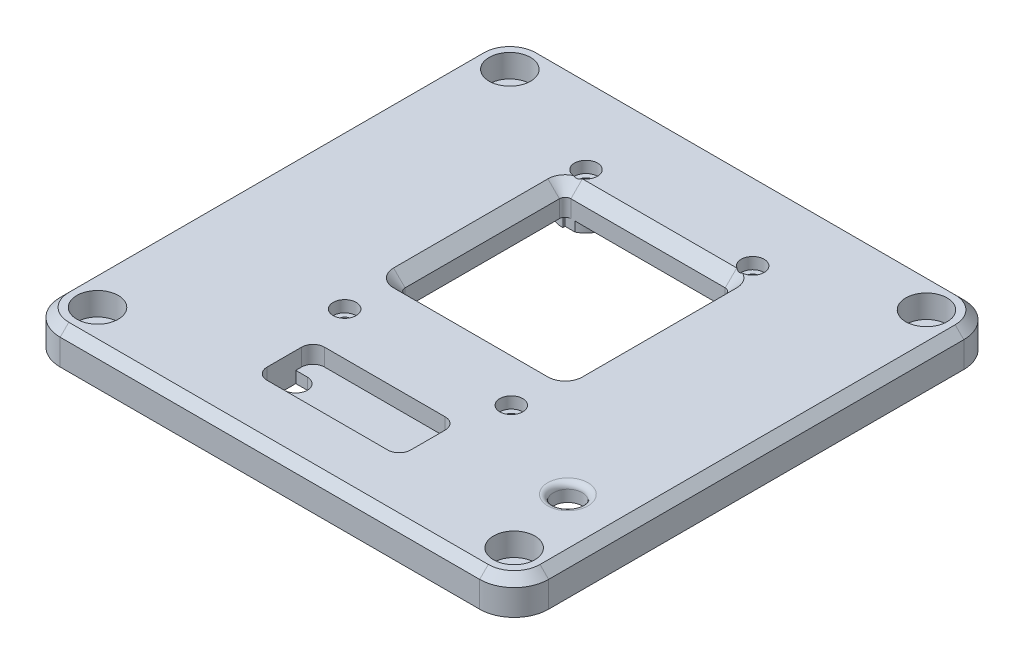
from build123d import *
from build123d.topology import SkipClean

# Parameters (mm, degrees)
SKETCH1_W                 = 85
SKETCH1_H                 = 84.25
SKETCH1_W_2               = 79
SKETCH1_H_2               = 78.25
BOSS_EXTRUDE1_DEPTH       = 3
BOSS_EXTRUDE2_START       = 3
SKETCH1_2_W               = 85
SKETCH1_2_H               = 84.25
SKETCH1_2_W_2             = 79
SKETCH1_2_H_2             = 78.25
BOSS_EXTRUDE2_DEPTH       = 3
FILLET1_R                 = 3
FILLET2_R                 = 6
CHAMFER1_SIZE             = 1.5
SKETCH3_W                 = 28.86
SKETCH3_H                 = 28.86
CUT_EXTRUDE1_DEPTH        = 61.139551254
FILLET3_R                 = 1
BOSS_EXTRUDE3_START       = 2
BOSS_EXTRUDE3_DEPTH       = 2
CHAMFER2_SIZE             = 2
SKETCH5_R                 = 1.1
CUT_EXTRUDE2_DEPTH        = 61.139551254
BOSS_EXTRUDE4_OUTLINE_R   = 1.1
BOSS_EXTRUDE4_OUTLINE_R_2 = 4.1
BOSS_EXTRUDE4_DEPTH       = 3.67
SKETCH7_R                 = 2.5
CUT_EXTRUDE3_DEPTH        = 61.210086572
SKETCH8_R                 = 2
CUT_EXTRUDE4_DEPTH        = 2
FILLET4_R                 = 1
SKETCH9_R                 = 2.05
CUT_EXTRUDE5_DEPTH        = 61.210086572
SKETCH9_3_R               = 3.6
SKETCH9_3_R_2             = 2.05
CUT_EXTRUDE6_DEPTH        = 4
BOSS_EXTRUDE7_START       = -3
SKETCH10_R                = 3.6
BOSS_EXTRUDE7_DEPTH       = 1
BOSS_EXTRUDE8_START       = -4
SKETCH10_4_R              = 3.6
SKETCH10_4_R_2            = 2.05
BOSS_EXTRUDE8_DEPTH       = 2
SKETCH11_W                = 25
SKETCH11_H                = 10
CUT_EXTRUDE7_DEPTH        = 3
SKETCH12_W                = 31
SKETCH12_H                = 16
BOSS_EXTRUDE9_DEPTH       = 2
FILLET5_R                 = 2


# Read off the part's stored shape, not the designer's step: Boss-Extrude4
with BuildPart() as part:
    # Sketch1 → Boss-Extrude1 (new body)
    with BuildSketch(Plane(origin=(0, 0, 0), x_dir=(1, 0, 0), z_dir=(0, 1, 0))):
        Rectangle(SKETCH1_W, SKETCH1_H)
        Rectangle(SKETCH1_W_2, SKETCH1_H_2, mode=Mode.SUBTRACT)
    extrude(amount=BOSS_EXTRUDE1_DEPTH)

    # Sketch1<2> → Boss-Extrude2 (add)
    # profile 1 of 2: a face of its own
    with BuildSketch(Plane(origin=(0, 0, 0), x_dir=(1, 0, 0), z_dir=(0, 1, 0)).offset(BOSS_EXTRUDE2_START)):
        Rectangle(SKETCH1_2_W, SKETCH1_2_H)
        Rectangle(SKETCH1_2_W_2, SKETCH1_2_H_2, mode=Mode.SUBTRACT)
    # profile 2 of 2: a face of its own
    with BuildSketch(Plane(origin=(0, 0, 0), x_dir=(1, 0, 0), z_dir=(0, 1, 0)).offset(BOSS_EXTRUDE2_START)):
        Rectangle(SKETCH1_2_W_2, SKETCH1_2_H_2)
    extrude(amount=BOSS_EXTRUDE2_DEPTH)

    # Fillet1
    fillet1_edges = [part.edges().sort_by_distance(p)[0] for p in [
        (-39.5, 1.5, -39.125),
        (-39.5, 1.5, 39.125),
        (39.5, 1.5, 39.125),
        (39.5, 1.5, -39.125),
    ]]
    fillet(fillet1_edges, radius=FILLET1_R)

    # Fillet2
    fillet2_edges = [part.edges().sort_by_distance(p)[0] for p in [
        (-42.5, 3, 42.125),
        (-42.5, 3, -42.125),
        (42.5, 3, -42.125),
        (42.5, 3, 42.125),
    ]]
    fillet(fillet2_edges, radius=FILLET2_R)

    # Chamfer1
    chamfer1_edges = [part.edges().sort_by_distance(p)[0] for p in [
        (42.5, 6, 0),
        (0, 6, 42.125),
        (0, 6, -42.125),
        (-42.5, 6, 0),
        (-40.742640687, 6, 40.367640687),
        (-40.742640687, 6, -40.367640687),
        (40.742640687, 6, -40.367640687),
        (40.742640687, 6, 40.367640687),
    ]]
    chamfer(chamfer1_edges, length=CHAMFER1_SIZE)

    # Sketch3 → Cut-Extrude1 (cut, through all)
    with BuildSketch(Plane(origin=(0, 6, 0), x_dir=(1, 0, 0), z_dir=(0, 1, 0))):
        with Locations((0, 9.25)):
            Rectangle(SKETCH3_W, SKETCH3_H)
    extrude(amount=-CUT_EXTRUDE1_DEPTH, mode=Mode.SUBTRACT)

    # Fillet3
    fillet3_edges = [part.edges().sort_by_distance(p)[0] for p in [
        (14.43, 4.5, -23.68),
        (14.43, 4.5, 5.18),
        (-14.43, 4.5, 5.18),
        (-14.43, 4.5, -23.68),
    ]]
    fillet(fillet3_edges, radius=FILLET3_R)

    # Sketch4 → Boss-Extrude3 (add)
    with BuildSketch(Plane.XZ.offset(-3).offset(BOSS_EXTRUDE3_START)):
        with BuildLine():
            Line((-17.43, 4.18), (-17.43, -22.68))
            ThreePointArc((-17.43, -22.68), (-16.258427125, -25.508427125), (-13.43, -26.68))
            Line((-13.43, -26.68), (13.43, -26.68))
            ThreePointArc((13.43, -26.68), (16.258427125, -25.508427125), (17.43, -22.68))
            Line((17.43, -22.68), (17.43, 4.18))
            ThreePointArc((17.43, 4.18), (16.258427125, 7.008427125), (13.43, 8.18))
            Line((13.43, 8.18), (-13.43, 8.18))
            ThreePointArc((-13.43, 8.18), (-16.258427125, 7.008427125), (-17.43, 4.18))
        make_face()
        with BuildLine():
            Line((-14.43, 4.18), (-14.43, -22.68))
            ThreePointArc((-14.43, -22.68), (-14.137106781, -23.387106781), (-13.43, -23.68))
            Line((-13.43, -23.68), (13.43, -23.68))
            ThreePointArc((13.43, -23.68), (14.137106781, -23.387106781), (14.43, -22.68))
            Line((14.43, -22.68), (14.43, 4.18))
            ThreePointArc((14.43, 4.18), (14.137106781, 4.887106781), (13.43, 5.18))
            Line((13.43, 5.18), (-13.43, 5.18))
            ThreePointArc((-13.43, 5.18), (-14.137106781, 4.887106781), (-14.43, 4.18))
        make_face(mode=Mode.SUBTRACT)
    extrude(amount=-BOSS_EXTRUDE3_DEPTH)

    # Chamfer2
    chamfer2_edges = [part.edges().sort_by_distance(p)[0] for p in [
        (14.43, 6, -9.25),
        (0, 6, 5.18),
        (-14.43, 6, -9.25),
        (0, 6, -23.68),
        (14.137106781, 6, 4.887106781),
        (-14.137106781, 6, 4.887106781),
        (-14.137106781, 6, -23.387106781),
        (14.137106781, 6, -23.387106781),
    ]]
    chamfer(chamfer2_edges, length=CHAMFER2_SIZE)

    # Sketch5 → Cut-Extrude2 (cut, through all)
    with BuildSketch(Plane(origin=(0, 6, 0), x_dir=(1, 0, 0), z_dir=(0, 1, 0))):
        with Locations(Location((-14.5, 27.38, 0), (0, 0, 270))):
            Circle(SKETCH5_R)
        with Locations(Location((14.5, 27.38, 0), (0, 0, 270))):
            Circle(SKETCH5_R)
        with Locations(Location((-14.5, -14.62, 0), (0, 0, 270))):
            Circle(SKETCH5_R)
        with Locations(Location((14.5, -14.62, 0), (0, 0, 270))):
            Circle(SKETCH5_R)
    extrude(amount=-CUT_EXTRUDE2_DEPTH, mode=Mode.SUBTRACT)

    # Boss-Extrude4 outline → Boss-Extrude4 (add)
    # profile 1 of 4: a face of its own
    with SkipClean():  # the faces are left unmerged after this step: merging them gives an invalid solid
        with BuildSketch(Plane.XZ.offset(-3)):
            with BuildLine():
                Line((14.43, -23.280597605), (14.43, -23.68))
                Line((14.43, -23.68), (12.733647827, -23.68))
                ThreePointArc((12.733647827, -23.68), (15.439642427, -31.370873602), (14.43, -23.280597605))
            make_face()
            with Locations((14.5, -27.38)):
                Circle(BOSS_EXTRUDE4_OUTLINE_R, mode=Mode.SUBTRACT)
        # profile 2 of 4: a face of its own
        with BuildSketch(Plane.XZ.offset(-3)):
            with BuildLine():
                Line((-12.733647827, -23.68), (-14.43, -23.68))
                Line((-14.43, -23.68), (-14.43, -23.280597605))
                ThreePointArc((-14.43, -23.280597605), (-15.439642427, -31.370873602), (-12.733647827, -23.68))
            make_face()
            with Locations((-14.5, -27.38)):
                Circle(BOSS_EXTRUDE4_OUTLINE_R, mode=Mode.SUBTRACT)
        # profile 3 of 4: a face of its own
        with BuildSketch(Plane.XZ.offset(-3)):
            with Locations((14.5, 14.62)):
                Circle(BOSS_EXTRUDE4_OUTLINE_R_2)
            with Locations((14.5, 14.62)):
                Circle(BOSS_EXTRUDE4_OUTLINE_R, mode=Mode.SUBTRACT)
        # profile 4 of 4: a face of its own
        with BuildSketch(Plane.XZ.offset(-3)):
            with Locations((-14.5, 14.62)):
                Circle(BOSS_EXTRUDE4_OUTLINE_R_2)
            with Locations((-14.5, 14.62)):
                Circle(BOSS_EXTRUDE4_OUTLINE_R, mode=Mode.SUBTRACT)
        extrude(amount=BOSS_EXTRUDE4_DEPTH)

    # Sketch7 → Cut-Extrude3 (cut, through all)
    with SkipClean():  # the faces are left unmerged after this step: merging them gives an invalid solid
        with BuildSketch(Plane(origin=(0, 6, 0), x_dir=(1, 0, 0), z_dir=(0, 1, 0))):
            with Locations(Location((32.85, -23.13, 0), (0, 0, 270))):
                Circle(SKETCH7_R)
        extrude(amount=-CUT_EXTRUDE3_DEPTH, mode=Mode.SUBTRACT)

    # Sketch8 → Cut-Extrude4 (cut)
    with SkipClean():  # the faces are left unmerged after this step: merging them gives an invalid solid
        with BuildSketch(Plane(origin=(0, 6, 0), x_dir=(1, 0, 0), z_dir=(0, 1, 0))):
            with Locations(Location((-14.5, 27.38, 0), (0, 0, 270))):
                Circle(SKETCH8_R)
            with Locations(Location((14.5, 27.38, 0), (0, 0, 270))):
                Circle(SKETCH8_R)
            with Locations(Location((14.5, -14.62, 0), (0, 0, 270))):
                Circle(SKETCH8_R)
            with Locations(Location((-14.5, -14.62, 0), (0, 0, 270))):
                Circle(SKETCH8_R)
        extrude(amount=-CUT_EXTRUDE4_DEPTH, mode=Mode.SUBTRACT)
    add(part.part.scale(1), mode=Mode.REPLACE)  # the faces are merged on a copy

    # Fillet4
    fillet4_edges = [part.edges().sort_by_distance(p)[0] for p in [
        (32.85, 6, 20.63),
    ]]
    fillet(fillet4_edges, radius=FILLET4_R)

    # Sketch9 → Cut-Extrude5 (cut, through all)
    with BuildSketch(Plane(origin=(0, 6, 0), x_dir=(1, 0, 0), z_dir=(0, 1, 0))):
        with Locations(Location((-36.25, 35.875, 0), (0, 0, 270))):
            Circle(SKETCH9_R)
        with Locations(Location((36.25, -35.875, 0), (0, 0, 270))):
            Circle(SKETCH9_R)
        with Locations(Location((-36.25, -35.875, 0), (0, 0, 270))):
            Circle(SKETCH9_R)
        with Locations(Location((36.25, 35.875, 0), (0, 0, 270))):
            Circle(SKETCH9_R)
    extrude(amount=-CUT_EXTRUDE5_DEPTH, mode=Mode.SUBTRACT)

    # Sketch9<3> → Cut-Extrude6 (cut)
    # profile 1 of 4: a face of its own
    with BuildSketch(Plane(origin=(0, 6, 0), x_dir=(1, 0, 0), z_dir=(0, 1, 0))):
        with Locations(Location((-36.25, 35.875, 0), (0, 0, 270))):
            Circle(SKETCH9_3_R)
        with Locations((-36.25, 35.875)):
            Circle(SKETCH9_3_R_2, mode=Mode.SUBTRACT)
    # profile 2 of 4: a face of its own
    with BuildSketch(Plane(origin=(0, 6, 0), x_dir=(1, 0, 0), z_dir=(0, 1, 0))):
        with Locations(Location((-36.25, -35.875, 0), (0, 0, 270))):
            Circle(SKETCH9_3_R)
        with Locations((-36.25, -35.875)):
            Circle(SKETCH9_3_R_2, mode=Mode.SUBTRACT)
    # profile 3 of 4: a face of its own
    with BuildSketch(Plane(origin=(0, 6, 0), x_dir=(1, 0, 0), z_dir=(0, 1, 0))):
        with Locations(Location((36.25, -35.875, 0), (0, 0, 270))):
            Circle(SKETCH9_3_R)
        with Locations((36.25, -35.875)):
            Circle(SKETCH9_3_R_2, mode=Mode.SUBTRACT)
    # profile 4 of 4: a face of its own
    with BuildSketch(Plane(origin=(0, 6, 0), x_dir=(1, 0, 0), z_dir=(0, 1, 0))):
        with Locations(Location((36.25, 35.875, 0), (0, 0, 270))):
            Circle(SKETCH9_3_R)
        with Locations((36.25, 35.875)):
            Circle(SKETCH9_3_R_2, mode=Mode.SUBTRACT)
    extrude(amount=-CUT_EXTRUDE6_DEPTH, mode=Mode.SUBTRACT)

    # Sketch10 → Boss-Extrude7 (add)
    # profile 1 of 4: a face of its own
    with BuildSketch(Plane(origin=(0, 6, 0), x_dir=(1, 0, 0), z_dir=(0, 1, 0)).offset(BOSS_EXTRUDE7_START)):
        with BuildLine():
            ThreePointArc((-30, 35.875), (-30.573287923, 38.489849899), (-32.187980798, 40.625))
            Line((-32.187980798, 40.625), (-36.5, 40.625))
            ThreePointArc((-36.5, 40.625), (-39.681980515, 39.306980515), (-41, 36.125))
            Line((-41, 36.125), (-41, 31.812980798))
            ThreePointArc((-41, 31.812980798), (-34.084936491, 30.0119803), (-30, 35.875))
        make_face()
        with Locations(Location((-36.25, 35.875, 0), (0, 0, 270))):
            Circle(SKETCH10_R, mode=Mode.SUBTRACT)
    # profile 2 of 4: a face of its own
    with BuildSketch(Plane(origin=(0, 6, 0), x_dir=(1, 0, 0), z_dir=(0, 1, 0)).offset(BOSS_EXTRUDE7_START)):
        with BuildLine():
            Line((36.5, 40.625), (32.187980798, 40.625))
            ThreePointArc((32.187980798, 40.625), (31.830582618, 31.455582618), (41, 31.812980798))
            Line((41, 31.812980798), (41, 36.125))
            ThreePointArc((41, 36.125), (39.681980515, 39.306980515), (36.5, 40.625))
        make_face()
        with Locations(Location((36.25, 35.875, 0), (0, 0, 270))):
            Circle(SKETCH10_R, mode=Mode.SUBTRACT)
    # profile 3 of 4: a face of its own
    with BuildSketch(Plane(origin=(0, 6, 0), x_dir=(1, 0, 0), z_dir=(0, 1, 0)).offset(BOSS_EXTRUDE7_START)):
        with BuildLine():
            Line((41, -36.125), (41, -31.812980798))
            ThreePointArc((41, -31.812980798), (31.830582618, -31.455582618), (32.187980798, -40.625))
            Line((32.187980798, -40.625), (36.5, -40.625))
            ThreePointArc((36.5, -40.625), (39.681980515, -39.306980515), (41, -36.125))
        make_face()
        with Locations(Location((36.25, -35.875, 0), (0, 0, 270))):
            Circle(SKETCH10_R, mode=Mode.SUBTRACT)
    # profile 4 of 4: a face of its own
    with BuildSketch(Plane(origin=(0, 6, 0), x_dir=(1, 0, 0), z_dir=(0, 1, 0)).offset(BOSS_EXTRUDE7_START)):
        with BuildLine():
            ThreePointArc((-30, -35.875), (-34.084936491, -30.0119803), (-41, -31.812980798))
            Line((-41, -31.812980798), (-41, -36.125))
            ThreePointArc((-41, -36.125), (-39.681980515, -39.306980515), (-36.5, -40.625))
            Line((-36.5, -40.625), (-32.187980798, -40.625))
            ThreePointArc((-32.187980798, -40.625), (-30.573287923, -38.489849899), (-30, -35.875))
        make_face()
        with Locations(Location((-36.25, -35.875, 0), (0, 0, 270))):
            Circle(SKETCH10_R, mode=Mode.SUBTRACT)
    extrude(amount=-BOSS_EXTRUDE7_DEPTH)

    # Sketch10<4> → Boss-Extrude8 (add)
    # profile 1 of 8: a face of its own
    with BuildSketch(Plane(origin=(0, 6, 0), x_dir=(1, 0, 0), z_dir=(0, 1, 0)).offset(BOSS_EXTRUDE8_START)):
        with BuildLine():
            Line((36.5, 40.625), (32.187980798, 40.625))
            ThreePointArc((32.187980798, 40.625), (31.830582618, 31.455582618), (41, 31.812980798))
            Line((41, 31.812980798), (41, 36.125))
            ThreePointArc((41, 36.125), (39.681980515, 39.306980515), (36.5, 40.625))
        make_face()
        with Locations(Location((36.25, 35.875, 0), (0, 0, 270))):
            Circle(SKETCH10_4_R, mode=Mode.SUBTRACT)
    # profile 2 of 8: a face of its own
    with BuildSketch(Plane(origin=(0, 6, 0), x_dir=(1, 0, 0), z_dir=(0, 1, 0)).offset(BOSS_EXTRUDE8_START)):
        with Locations(Location((36.25, 35.875, 0), (0, 0, 270))):
            Circle(SKETCH10_4_R)
        with Locations(Location((36.25, 35.875, 0), (0, 0, 90))):
            Circle(SKETCH10_4_R_2, mode=Mode.SUBTRACT)
    # profile 3 of 8: a face of its own
    with BuildSketch(Plane(origin=(0, 6, 0), x_dir=(1, 0, 0), z_dir=(0, 1, 0)).offset(BOSS_EXTRUDE8_START)):
        with BuildLine():
            Line((41, -36.125), (41, -31.812980798))
            ThreePointArc((41, -31.812980798), (31.830582618, -31.455582618), (32.187980798, -40.625))
            Line((32.187980798, -40.625), (36.5, -40.625))
            ThreePointArc((36.5, -40.625), (39.681980515, -39.306980515), (41, -36.125))
        make_face()
        with Locations(Location((36.25, -35.875, 0), (0, 0, 270))):
            Circle(SKETCH10_4_R, mode=Mode.SUBTRACT)
    # profile 4 of 8: a face of its own
    with BuildSketch(Plane(origin=(0, 6, 0), x_dir=(1, 0, 0), z_dir=(0, 1, 0)).offset(BOSS_EXTRUDE8_START)):
        with Locations(Location((36.25, -35.875, 0), (0, 0, 270))):
            Circle(SKETCH10_4_R)
        with Locations(Location((36.25, -35.875, 0), (0, 0, 90))):
            Circle(SKETCH10_4_R_2, mode=Mode.SUBTRACT)
    # profile 5 of 8: a face of its own
    with BuildSketch(Plane(origin=(0, 6, 0), x_dir=(1, 0, 0), z_dir=(0, 1, 0)).offset(BOSS_EXTRUDE8_START)):
        with BuildLine():
            ThreePointArc((-30, -35.875), (-34.084936491, -30.0119803), (-41, -31.812980798))
            Line((-41, -31.812980798), (-41, -36.125))
            ThreePointArc((-41, -36.125), (-39.681980515, -39.306980515), (-36.5, -40.625))
            Line((-36.5, -40.625), (-32.187980798, -40.625))
            ThreePointArc((-32.187980798, -40.625), (-30.573287923, -38.489849899), (-30, -35.875))
        make_face()
        with Locations(Location((-36.25, -35.875, 0), (0, 0, 270))):
            Circle(SKETCH10_4_R, mode=Mode.SUBTRACT)
    # profile 6 of 8: a face of its own
    with BuildSketch(Plane(origin=(0, 6, 0), x_dir=(1, 0, 0), z_dir=(0, 1, 0)).offset(BOSS_EXTRUDE8_START)):
        with Locations(Location((-36.25, -35.875, 0), (0, 0, 270))):
            Circle(SKETCH10_4_R)
        with Locations(Location((-36.25, -35.875, 0), (0, 0, 90))):
            Circle(SKETCH10_4_R_2, mode=Mode.SUBTRACT)
    # profile 7 of 8: a face of its own
    with BuildSketch(Plane(origin=(0, 6, 0), x_dir=(1, 0, 0), z_dir=(0, 1, 0)).offset(BOSS_EXTRUDE8_START)):
        with BuildLine():
            ThreePointArc((-30, 35.875), (-30.573287923, 38.489849899), (-32.187980798, 40.625))
            Line((-32.187980798, 40.625), (-36.5, 40.625))
            ThreePointArc((-36.5, 40.625), (-39.681980515, 39.306980515), (-41, 36.125))
            Line((-41, 36.125), (-41, 31.812980798))
            ThreePointArc((-41, 31.812980798), (-34.084936491, 30.0119803), (-30, 35.875))
        make_face()
        with Locations(Location((-36.25, 35.875, 0), (0, 0, 270))):
            Circle(SKETCH10_4_R, mode=Mode.SUBTRACT)
    # profile 8 of 8: a face of its own
    with BuildSketch(Plane(origin=(0, 6, 0), x_dir=(1, 0, 0), z_dir=(0, 1, 0)).offset(BOSS_EXTRUDE8_START)):
        with Locations(Location((-36.25, 35.875, 0), (0, 0, 270))):
            Circle(SKETCH10_4_R)
        with Locations(Location((-36.25, 35.875, 0), (0, 0, 90))):
            Circle(SKETCH10_4_R_2, mode=Mode.SUBTRACT)
    extrude(amount=-BOSS_EXTRUDE8_DEPTH)

    # Sketch11 → Cut-Extrude7 (cut)
    with BuildSketch(Plane(origin=(0, 6, 0), x_dir=(1, 0, 0), z_dir=(0, 1, 0))):
        with Locations((0, -27.125)):
            Rectangle(SKETCH11_W, SKETCH11_H)
    extrude(amount=-CUT_EXTRUDE7_DEPTH, mode=Mode.SUBTRACT)

    # Sketch12 → Boss-Extrude9 (add)
    # profile 1 of 2: a face of its own
    with BuildSketch(Plane.XZ.offset(-3)):
        with Locations((0, 27.125)):
            Rectangle(SKETCH12_W, SKETCH12_H)
        Polygon((-12.5, 32.125), (12.5, 32.125), (12.5, 22.125), (-12.5, 22.125), (-12.5, 25.125), (-12.5, 29.125), align=None, mode=Mode.SUBTRACT)
    # profile 2 of 2: a face of its own
    with BuildSketch(Plane.XZ.offset(-3)):
        Polygon((12.5, 22.125), (12.5, 32.125), (-12.5, 32.125), (-12.5, 29.125), (-8.5, 29.125), (-8.5, 25.125), (-12.5, 25.125), (-12.5, 22.125), align=None)
    extrude(amount=BOSS_EXTRUDE9_DEPTH)

    # Fillet5
    fillet5_edges = [part.edges().sort_by_distance(p)[0] for p in [
        (-8.5, 2, 29.125),
        (-8.5, 2, 25.125),
        (-12.5, 4.5, 32.125),
        (12.5, 4.5, 32.125),
        (12.5, 4.5, 22.125),
        (-12.5, 4.5, 22.125),
    ]]
    fillet(fillet5_edges, radius=FILLET5_R - 0.0001)  # a hair under: the kernel refuses the full size


solid = part.part
